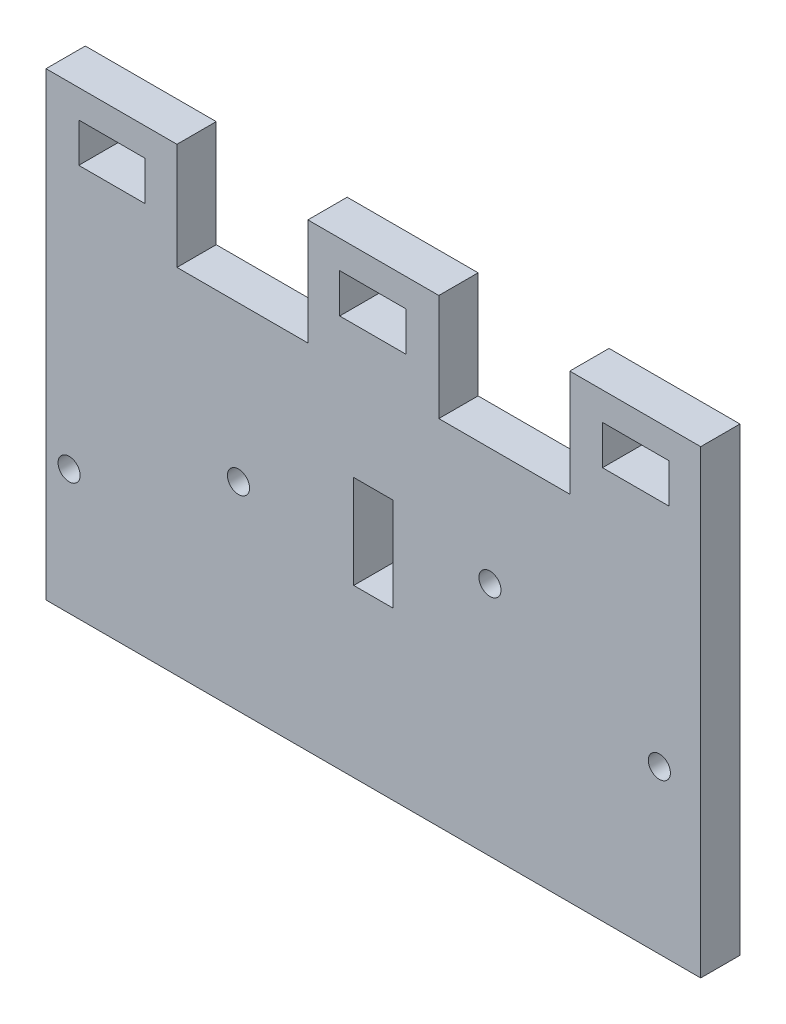
from build123d import *

# Parameters (mm, degrees)
SKETCH1_W           = 88.9
SKETCH1_H           = 62.484
BOSS_EXTRUDE1_DEPTH = 5.334
SKETCH2_W           = 17.78
SKETCH2_H           = 14.478
CUT_EXTRUDE1_DEPTH  = 70.229357574
SKETCH3_W           = 9.017
SKETCH3_H           = 5.334
CUT_EXTRUDE2_DEPTH  = 70.229357574
SKETCH5_W           = 5.334
SKETCH5_H           = 12.7
CUT_EXTRUDE3_DEPTH  = 70.229357574
SKETCH7_R           = 1.5
CUT_EXTRUDE4_DEPTH  = 70.229357574


with BuildPart() as part:
    # Sketch1 → Boss-Extrude1 (new body)
    with BuildSketch(Plane.XY):
        with Locations((5.089694656, -16.821198473)):
            Rectangle(SKETCH1_W, SKETCH1_H)
    extrude(amount=BOSS_EXTRUDE1_DEPTH)

    # Sketch2 → Cut-Extrude1 (cut, through all)
    with BuildSketch(Plane.XY.offset(5.334)):
        with Locations((-12.690305344, 7.181801527)):
            Rectangle(SKETCH2_W, SKETCH2_H)
        with Locations((22.869694656, 7.181801527)):
            Rectangle(SKETCH2_W, SKETCH2_H)
    extrude(amount=-CUT_EXTRUDE1_DEPTH, mode=Mode.SUBTRACT)

    # Sketch3 → Cut-Extrude2 (cut, through all)
    with BuildSketch(Plane.XY.offset(5.334)):
        with Locations((-30.406805344, 7.943801527)):
            Rectangle(SKETCH3_W, SKETCH3_H)
        with Locations((5.026194656, 7.943801527)):
            Rectangle(SKETCH3_W, SKETCH3_H)
        with Locations((40.713194656, 7.943801527)):
            Rectangle(SKETCH3_W, SKETCH3_H)
    extrude(amount=-CUT_EXTRUDE2_DEPTH, mode=Mode.SUBTRACT)

    # Sketch5 → Cut-Extrude3 (cut, through all)
    with BuildSketch(Plane.XY.offset(5.334)):
        with Locations((5.089694656, -19.107198473)):
            Rectangle(SKETCH5_W, SKETCH5_H)
    extrude(amount=-CUT_EXTRUDE3_DEPTH, mode=Mode.SUBTRACT)

    # Sketch7 → Cut-Extrude4 (cut, through all)
    with BuildSketch(Plane.XY.offset(5.334)):
        with Locations((-36.225305344, -31.091198473)):
            Circle(SKETCH7_R)
        with Locations((-13.225305344, -21.091198473)):
            Circle(SKETCH7_R)
        with Locations((20.924694656, -16.011198473)):
            Circle(SKETCH7_R)
        with Locations((43.924694656, -26.011198473)):
            Circle(SKETCH7_R)
    extrude(amount=-CUT_EXTRUDE4_DEPTH, mode=Mode.SUBTRACT)


solid = part.part
